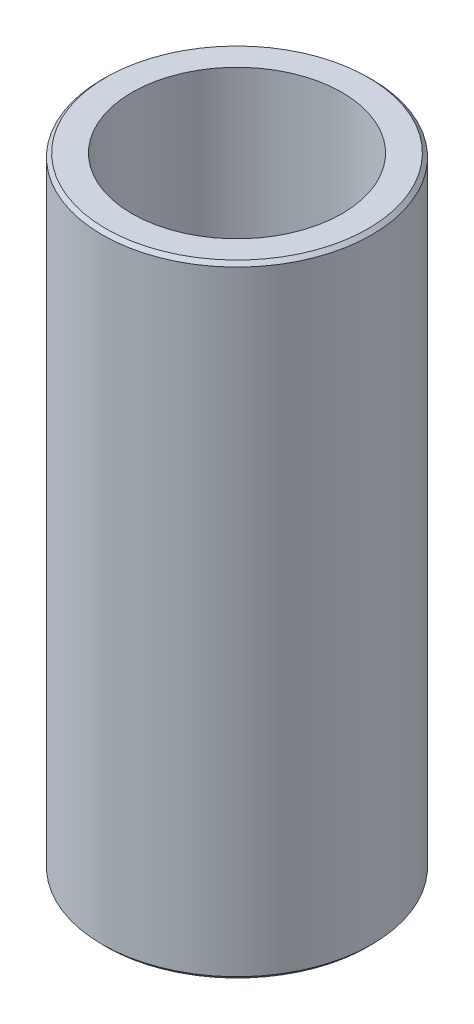
from build123d import *
from OCP.BRepFilletAPI import BRepFilletAPI_MakeChamfer

# Parameters (mm, degrees)
SKETCH1_R           = 30
BOSS_EXTRUDE1_DEPTH = 138.411285043
SKETCH2_R           = 23.390178152
CUT_EXTRUDE1_DEPTH  = 145.767689169
CHAMFER1_SIZE       = 0.782545057
CHAMFER1_SIZE2      = 0.812186501


with BuildPart() as part:
    # Sketch1 → Boss-Extrude1 (new body)
    with BuildSketch(Plane(origin=(0, 0, 0), x_dir=(1, 0, 0), z_dir=(0, 1, 0))):
        Circle(SKETCH1_R)
    extrude(amount=BOSS_EXTRUDE1_DEPTH)

    # Sketch2 → Cut-Extrude1 (cut, through all)
    with BuildSketch(Plane(origin=(0, 0, 0), x_dir=(1, 0, 0), z_dir=(0, 1, 0))):
        Circle(SKETCH2_R)
    extrude(amount=CUT_EXTRUDE1_DEPTH, mode=Mode.SUBTRACT)

    # Chamfer1: one chamfer whose edges measure the first distance from different faces: ONE call of the kernel's chamfer builder (chamfer() names one face for all edges)
    chamfer1_edges_1 = [part.edges().sort_by_distance(p)[0] for p in [
        (-30, 138.411285043, 0),
    ]]
    chamfer1_side_1 = [part.faces().sort_by_distance(p)[0] for p in [
        (-30, 69.205642521, 0),
    ]]
    chamfer1_edges_2 = [part.edges().sort_by_distance(p)[0] for p in [
        (-30, 0, 0),
    ]]
    chamfer1_side_2 = [part.faces().sort_by_distance(p)[0] for p in [
        (-29.151471863, 0, 0),
    ]]
    chamfer1 = BRepFilletAPI_MakeChamfer(part.part.solid().wrapped)
    for e in chamfer1_edges_1:
        chamfer1.Add(CHAMFER1_SIZE, CHAMFER1_SIZE2, e.wrapped, chamfer1_side_1[0].wrapped)  # the first distance lies on this face
    for e in chamfer1_edges_2:
        chamfer1.Add(CHAMFER1_SIZE, CHAMFER1_SIZE2, e.wrapped, chamfer1_side_2[0].wrapped)  # the first distance lies on this face
    add(Compound.cast(chamfer1.Shape()), mode=Mode.REPLACE)


solid = part.part
